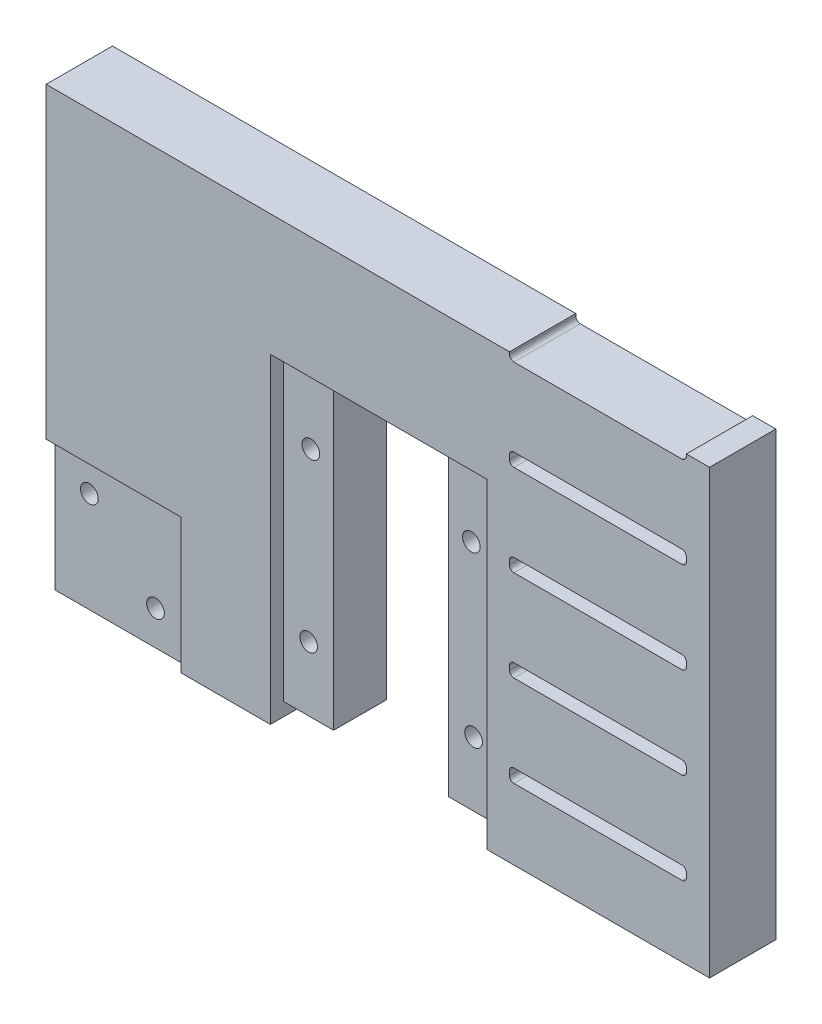
from build123d import *

# Parameters (mm, degrees)
CROQUIS1_W              = 300
CROQUIS1_H              = 200
SALIENTE_EXTRUIR1_DEPTH = 15
CROQUIS2_W              = 30.5
CROQUIS2_H              = 30.5
HUECOS_COLUMNA_DEPTH    = 2
HUECOS_MOTOR_DEPTH      = 181.900525151
CROQUIS4_R              = 2
SIDE_SCREWS_1_DEPTH     = 15
SIDE_START              = -15
CROQUIS5_R              = 2
SIDE_SCREWS_2_DEPTH     = 15
CROQUIS7_R              = 2
SCREWS_AND_VENTI_DEPTH  = 15
CROQUIS9_W              = 49
CROQUIS9_H              = 69.5
CORTAR_EXTRUIR6_DEPTH   = 3
CROQUIS11_W             = 15
CROQUIS11_H             = 200
CORTAR_EXTRUIR7_DEPTH   = 150
CROQUIS12_W             = 150
CROQUIS12_H             = 15
CORTAR_EXTRUIR8_DEPTH   = 100


with BuildPart() as part:
    # Croquis1 → Saliente-Extruir1 (new body)
    with BuildSketch(Plane.XY):
        Rectangle(CROQUIS1_W, CROQUIS1_H)
    extrude(amount=SALIENTE_EXTRUIR1_DEPTH)

    # Croquis2 → Huecos columna (cut)
    with BuildSketch(Plane.XY.offset(15)):
        with Locations((-134.75, 84.75)):
            Rectangle(CROQUIS2_W, CROQUIS2_H)
        with Locations((134.75, 84.75)):
            Rectangle(CROQUIS2_W, CROQUIS2_H)
        with Locations((134.75, -84.75)):
            Rectangle(CROQUIS2_W, CROQUIS2_H)
        with Locations((-134.75, -84.75)):
            Rectangle(CROQUIS2_W, CROQUIS2_H)
    extrude(amount=-HUECOS_COLUMNA_DEPTH, mode=Mode.SUBTRACT)

    # Croquis3 → huecos motor (cut, through all)
    with BuildSketch(Plane.XY.offset(15)):
        Polygon((-88, -97), (-88, -27.5), (-62, -27.5), (-62, -97), (-50.295392228, -97), (-50.295392228, -100), (-99.295392228, -100), (-99.295392228, -97), align=None)
        Polygon((88, -27.5), (62, -27.5), (62, -97), (50.295392228, -97), (50.295392228, -100), (99.295392228, -100), (99.295392228, -97), (88, -97), align=None)
        Polygon((88, 97), (88, 27.5), (62, 27.5), (62, 97), (50.295392228, 97), (50.295392228, 100), (99.295392228, 100), (99.295392228, 97), align=None)
        Polygon((-88, 27.5), (-62, 27.5), (-62, 97), (-50.295392228, 97), (-50.295392228, 100), (-99.295392228, 100), (-99.295392228, 97), (-88, 97), align=None)
    extrude(amount=-HUECOS_MOTOR_DEPTH, mode=Mode.SUBTRACT)

    # Croquis4 → side_screws 1 (cut)
    with BuildSketch(Plane.XZ.offset(97)):
        with Locations((-93.647696114, 7.5)):
            Circle(CROQUIS4_R)
        with Locations((-56.352303886, 7.5)):
            Circle(CROQUIS4_R)
        with Locations((56.352303886, 7.5)):
            Circle(CROQUIS4_R)
        with Locations((93.647696114, 7.5)):
            Circle(CROQUIS4_R)
    extrude(amount=-SIDE_SCREWS_1_DEPTH, mode=Mode.SUBTRACT)

    # Croquis5 → side screws 2 (cut)
    with BuildSketch(Plane(origin=(0, 97, 0), x_dir=(1, 0, 0), z_dir=(0, 1, 0)).offset(SIDE_START)):
        with Locations((-93.647696114, -7.5)):
            Circle(CROQUIS5_R)
        with Locations((-56.352303886, -7.5)):
            Circle(CROQUIS5_R)
        with Locations((56.352303886, -7.5)):
            Circle(CROQUIS5_R)
        with Locations((93.647696114, -7.5)):
            Circle(CROQUIS5_R)
    extrude(amount=SIDE_SCREWS_2_DEPTH, mode=Mode.SUBTRACT)

    # Croquis7 → screws and venti (cut)
    with BuildSketch(Plane.XY.offset(15)):
        with Locations((-127.278174593, -92.221825407)):
            Circle(CROQUIS7_R)
        with Locations((-142.221825407, -77.278174593)):
            Circle(CROQUIS7_R)
        with Locations((-127.278174593, 92.221825407)):
            Circle(CROQUIS7_R)
        with Locations((-142.221825407, 77.278174593)):
            Circle(CROQUIS7_R)
        with Locations((127.278174593, -92.221825407)):
            Circle(CROQUIS7_R)
        with Locations((142.221825407, -77.278174593)):
            Circle(CROQUIS7_R)
        with Locations((127.278174593, 92.221825407)):
            Circle(CROQUIS7_R)
        with Locations((142.221825407, 77.278174593)):
            Circle(CROQUIS7_R)
        with Locations((-93.647696114, -82.5)):
            Circle(CROQUIS7_R)
        with Locations((-93.147733982, -44.503289118)):
            Circle(CROQUIS7_R)
        with Locations((-56.352303886, -82.5)):
            Circle(CROQUIS7_R)
        with Locations((-56.852266018, -44.503289118)):
            Circle(CROQUIS7_R)
        with Locations((56.852266018, -44.503289118)):
            Circle(CROQUIS7_R)
        with Locations((56.352303886, -82.5)):
            Circle(CROQUIS7_R)
        with Locations((93.647696114, -82.5)):
            Circle(CROQUIS7_R)
        with Locations((93.147733982, -44.503289118)):
            Circle(CROQUIS7_R)
        with Locations((93.647696114, 82.5)):
            Circle(CROQUIS7_R)
        with Locations((93.147733982, 44.503289118)):
            Circle(CROQUIS7_R)
        with Locations((56.352303886, 82.5)):
            Circle(CROQUIS7_R)
        with Locations((56.852266018, 44.503289118)):
            Circle(CROQUIS7_R)
        with Locations((-56.352303886, 82.5)):
            Circle(CROQUIS7_R)
        with Locations((-56.852266018, 44.503289118)):
            Circle(CROQUIS7_R)
        with Locations((-93.647696114, 82.5)):
            Circle(CROQUIS7_R)
        with Locations((-93.147733982, 44.503289118)):
            Circle(CROQUIS7_R)
        with BuildLine():
            Line((6.875948392, 84), (44.875948392, 84))
            ThreePointArc((44.875948392, 84), (45.583055173, 83.707106781), (45.875948392, 83))
            Line((45.875948392, 83), (45.875948392, 82))
            ThreePointArc((45.875948392, 82), (45.583055173, 81.292893219), (44.875948392, 81))
            Line((44.875948392, 81), (6.875948392, 81))
            ThreePointArc((6.875948392, 81), (6.168841611, 81.292893219), (5.875948392, 82))
            Line((5.875948392, 82), (5.875948392, 83))
            ThreePointArc((5.875948392, 83), (6.168841611, 83.707106781), (6.875948392, 84))
        make_face()
        with BuildLine():
            Line((-44.236036181, 81), (-6.236036181, 81))
            ThreePointArc((-6.236036181, 81), (-5.5289294, 81.292893219), (-5.236036181, 82))
            Line((-5.236036181, 82), (-5.236036181, 83))
            ThreePointArc((-5.236036181, 83), (-5.5289294, 83.707106781), (-6.236036181, 84))
            Line((-6.236036181, 84), (-44.236036181, 84))
            ThreePointArc((-44.236036181, 84), (-44.943142962, 83.707106781), (-45.236036181, 83))
            Line((-45.236036181, 83), (-45.236036181, 82))
            ThreePointArc((-45.236036181, 82), (-44.943142962, 81.292893219), (-44.236036181, 81))
        make_face()
        with BuildLine():
            Line((6.875948392, 63.375), (44.875948392, 63.375))
            ThreePointArc((44.875948392, 63.375), (45.583055173, 63.082106781), (45.875948392, 62.375))
            Line((45.875948392, 62.375), (45.875948392, 61.375))
            ThreePointArc((45.875948392, 61.375), (45.583055173, 60.667893219), (44.875948392, 60.375))
            Line((44.875948392, 60.375), (6.875948392, 60.375))
            ThreePointArc((6.875948392, 60.375), (6.168841611, 60.667893219), (5.875948392, 61.375))
            Line((5.875948392, 61.375), (5.875948392, 62.375))
            ThreePointArc((5.875948392, 62.375), (6.168841611, 63.082106781), (6.875948392, 63.375))
        make_face()
        with BuildLine():
            Line((6.875948392, 42.75), (44.875948392, 42.75))
            ThreePointArc((44.875948392, 42.75), (45.583055173, 42.457106781), (45.875948392, 41.75))
            Line((45.875948392, 41.75), (45.875948392, 40.75))
            ThreePointArc((45.875948392, 40.75), (45.583055173, 40.042893219), (44.875948392, 39.75))
            Line((44.875948392, 39.75), (6.875948392, 39.75))
            ThreePointArc((6.875948392, 39.75), (6.168841611, 40.042893219), (5.875948392, 40.75))
            Line((5.875948392, 40.75), (5.875948392, 41.75))
            ThreePointArc((5.875948392, 41.75), (6.168841611, 42.457106781), (6.875948392, 42.75))
        make_face()
        with BuildLine():
            Line((6.875948392, 22.125), (44.875948392, 22.125))
            ThreePointArc((44.875948392, 22.125), (45.583055173, 21.832106781), (45.875948392, 21.125))
            Line((45.875948392, 21.125), (45.875948392, 20.125))
            ThreePointArc((45.875948392, 20.125), (45.583055173, 19.417893219), (44.875948392, 19.125))
            Line((44.875948392, 19.125), (6.875948392, 19.125))
            ThreePointArc((6.875948392, 19.125), (6.168841611, 19.417893219), (5.875948392, 20.125))
            Line((5.875948392, 20.125), (5.875948392, 21.125))
            ThreePointArc((5.875948392, 21.125), (6.168841611, 21.832106781), (6.875948392, 22.125))
        make_face()
        with BuildLine():
            Line((6.875948392, 1.5), (44.875948392, 1.5))
            ThreePointArc((44.875948392, 1.5), (45.583055173, 1.207106781), (45.875948392, 0.5))
            Line((45.875948392, 0.5), (45.875948392, -0.5))
            ThreePointArc((45.875948392, -0.5), (45.583055173, -1.207106781), (44.875948392, -1.5))
            Line((44.875948392, -1.5), (6.875948392, -1.5))
            ThreePointArc((6.875948392, -1.5), (6.168841611, -1.207106781), (5.875948392, -0.5))
            Line((5.875948392, -0.5), (5.875948392, 0.5))
            ThreePointArc((5.875948392, 0.5), (6.168841611, 1.207106781), (6.875948392, 1.5))
        make_face()
        with BuildLine():
            Line((6.875948392, -19.125), (44.875948392, -19.125))
            ThreePointArc((44.875948392, -19.125), (45.583055173, -19.417893219), (45.875948392, -20.125))
            Line((45.875948392, -20.125), (45.875948392, -21.125))
            ThreePointArc((45.875948392, -21.125), (45.583055173, -21.832106781), (44.875948392, -22.125))
            Line((44.875948392, -22.125), (6.875948392, -22.125))
            ThreePointArc((6.875948392, -22.125), (6.168841611, -21.832106781), (5.875948392, -21.125))
            Line((5.875948392, -21.125), (5.875948392, -20.125))
            ThreePointArc((5.875948392, -20.125), (6.168841611, -19.417893219), (6.875948392, -19.125))
        make_face()
        with BuildLine():
            Line((6.875948392, -39.75), (44.875948392, -39.75))
            ThreePointArc((44.875948392, -39.75), (45.583055173, -40.042893219), (45.875948392, -40.75))
            Line((45.875948392, -40.75), (45.875948392, -41.75))
            ThreePointArc((45.875948392, -41.75), (45.583055173, -42.457106781), (44.875948392, -42.75))
            Line((44.875948392, -42.75), (6.875948392, -42.75))
            ThreePointArc((6.875948392, -42.75), (6.168841611, -42.457106781), (5.875948392, -41.75))
            Line((5.875948392, -41.75), (5.875948392, -40.75))
            ThreePointArc((5.875948392, -40.75), (6.168841611, -40.042893219), (6.875948392, -39.75))
        make_face()
        with BuildLine():
            Line((6.875948392, -60.375), (44.875948392, -60.375))
            ThreePointArc((44.875948392, -60.375), (45.583055173, -60.667893219), (45.875948392, -61.375))
            Line((45.875948392, -61.375), (45.875948392, -62.375))
            ThreePointArc((45.875948392, -62.375), (45.583055173, -63.082106781), (44.875948392, -63.375))
            Line((44.875948392, -63.375), (6.875948392, -63.375))
            ThreePointArc((6.875948392, -63.375), (6.168841611, -63.082106781), (5.875948392, -62.375))
            Line((5.875948392, -62.375), (5.875948392, -61.375))
            ThreePointArc((5.875948392, -61.375), (6.168841611, -60.667893219), (6.875948392, -60.375))
        make_face()
        with BuildLine():
            Line((6.875948392, -81), (44.875948392, -81))
            ThreePointArc((44.875948392, -81), (45.583055173, -81.292893219), (45.875948392, -82))
            Line((45.875948392, -82), (45.875948392, -83))
            ThreePointArc((45.875948392, -83), (45.583055173, -83.707106781), (44.875948392, -84))
            Line((44.875948392, -84), (6.875948392, -84))
            ThreePointArc((6.875948392, -84), (6.168841611, -83.707106781), (5.875948392, -83))
            Line((5.875948392, -83), (5.875948392, -82))
            ThreePointArc((5.875948392, -82), (6.168841611, -81.292893219), (6.875948392, -81))
        make_face()
        with BuildLine():
            Line((-44.236036181, 63.375), (-6.236036181, 63.375))
            ThreePointArc((-6.236036181, 63.375), (-5.5289294, 63.082106781), (-5.236036181, 62.375))
            Line((-5.236036181, 62.375), (-5.236036181, 61.375))
            ThreePointArc((-5.236036181, 61.375), (-5.5289294, 60.667893219), (-6.236036181, 60.375))
            Line((-6.236036181, 60.375), (-44.236036181, 60.375))
            ThreePointArc((-44.236036181, 60.375), (-44.943142962, 60.667893219), (-45.236036181, 61.375))
            Line((-45.236036181, 61.375), (-45.236036181, 62.375))
            ThreePointArc((-45.236036181, 62.375), (-44.943142962, 63.082106781), (-44.236036181, 63.375))
        make_face()
        with BuildLine():
            Line((-44.236036181, 42.75), (-6.236036181, 42.75))
            ThreePointArc((-6.236036181, 42.75), (-5.5289294, 42.457106781), (-5.236036181, 41.75))
            Line((-5.236036181, 41.75), (-5.236036181, 40.75))
            ThreePointArc((-5.236036181, 40.75), (-5.5289294, 40.042893219), (-6.236036181, 39.75))
            Line((-6.236036181, 39.75), (-44.236036181, 39.75))
            ThreePointArc((-44.236036181, 39.75), (-44.943142962, 40.042893219), (-45.236036181, 40.75))
            Line((-45.236036181, 40.75), (-45.236036181, 41.75))
            ThreePointArc((-45.236036181, 41.75), (-44.943142962, 42.457106781), (-44.236036181, 42.75))
        make_face()
        with BuildLine():
            Line((-44.236036181, 22.125), (-6.236036181, 22.125))
            ThreePointArc((-6.236036181, 22.125), (-5.5289294, 21.832106781), (-5.236036181, 21.125))
            Line((-5.236036181, 21.125), (-5.236036181, 20.125))
            ThreePointArc((-5.236036181, 20.125), (-5.5289294, 19.417893219), (-6.236036181, 19.125))
            Line((-6.236036181, 19.125), (-44.236036181, 19.125))
            ThreePointArc((-44.236036181, 19.125), (-44.943142962, 19.417893219), (-45.236036181, 20.125))
            Line((-45.236036181, 20.125), (-45.236036181, 21.125))
            ThreePointArc((-45.236036181, 21.125), (-44.943142962, 21.832106781), (-44.236036181, 22.125))
        make_face()
        with BuildLine():
            Line((-44.236036181, 1.5), (-6.236036181, 1.5))
            ThreePointArc((-6.236036181, 1.5), (-5.5289294, 1.207106781), (-5.236036181, 0.5))
            Line((-5.236036181, 0.5), (-5.236036181, -0.5))
            ThreePointArc((-5.236036181, -0.5), (-5.5289294, -1.207106781), (-6.236036181, -1.5))
            Line((-6.236036181, -1.5), (-44.236036181, -1.5))
            ThreePointArc((-44.236036181, -1.5), (-44.943142962, -1.207106781), (-45.236036181, -0.5))
            Line((-45.236036181, -0.5), (-45.236036181, 0.5))
            ThreePointArc((-45.236036181, 0.5), (-44.943142962, 1.207106781), (-44.236036181, 1.5))
        make_face()
        with BuildLine():
            Line((-44.236036181, -19.125), (-6.236036181, -19.125))
            ThreePointArc((-6.236036181, -19.125), (-5.5289294, -19.417893219), (-5.236036181, -20.125))
            Line((-5.236036181, -20.125), (-5.236036181, -21.125))
            ThreePointArc((-5.236036181, -21.125), (-5.5289294, -21.832106781), (-6.236036181, -22.125))
            Line((-6.236036181, -22.125), (-44.236036181, -22.125))
            ThreePointArc((-44.236036181, -22.125), (-44.943142962, -21.832106781), (-45.236036181, -21.125))
            Line((-45.236036181, -21.125), (-45.236036181, -20.125))
            ThreePointArc((-45.236036181, -20.125), (-44.943142962, -19.417893219), (-44.236036181, -19.125))
        make_face()
        with BuildLine():
            Line((-44.236036181, -39.75), (-6.236036181, -39.75))
            ThreePointArc((-6.236036181, -39.75), (-5.5289294, -40.042893219), (-5.236036181, -40.75))
            Line((-5.236036181, -40.75), (-5.236036181, -41.75))
            ThreePointArc((-5.236036181, -41.75), (-5.5289294, -42.457106781), (-6.236036181, -42.75))
            Line((-6.236036181, -42.75), (-44.236036181, -42.75))
            ThreePointArc((-44.236036181, -42.75), (-44.943142962, -42.457106781), (-45.236036181, -41.75))
            Line((-45.236036181, -41.75), (-45.236036181, -40.75))
            ThreePointArc((-45.236036181, -40.75), (-44.943142962, -40.042893219), (-44.236036181, -39.75))
        make_face()
        with BuildLine():
            Line((-44.236036181, -60.375), (-6.236036181, -60.375))
            ThreePointArc((-6.236036181, -60.375), (-5.5289294, -60.667893219), (-5.236036181, -61.375))
            Line((-5.236036181, -61.375), (-5.236036181, -62.375))
            ThreePointArc((-5.236036181, -62.375), (-5.5289294, -63.082106781), (-6.236036181, -63.375))
            Line((-6.236036181, -63.375), (-44.236036181, -63.375))
            ThreePointArc((-44.236036181, -63.375), (-44.943142962, -63.082106781), (-45.236036181, -62.375))
            Line((-45.236036181, -62.375), (-45.236036181, -61.375))
            ThreePointArc((-45.236036181, -61.375), (-44.943142962, -60.667893219), (-44.236036181, -60.375))
        make_face()
        with BuildLine():
            Line((-44.236036181, -81), (-6.236036181, -81))
            ThreePointArc((-6.236036181, -81), (-5.5289294, -81.292893219), (-5.236036181, -82))
            Line((-5.236036181, -82), (-5.236036181, -83))
            ThreePointArc((-5.236036181, -83), (-5.5289294, -83.707106781), (-6.236036181, -84))
            Line((-6.236036181, -84), (-44.236036181, -84))
            ThreePointArc((-44.236036181, -84), (-44.943142962, -83.707106781), (-45.236036181, -83))
            Line((-45.236036181, -83), (-45.236036181, -82))
            ThreePointArc((-45.236036181, -82), (-44.943142962, -81.292893219), (-44.236036181, -81))
        make_face()
    extrude(amount=-SCREWS_AND_VENTI_DEPTH, mode=Mode.SUBTRACT)

    # Croquis9 → Cortar-Extruir6 (cut)
    with BuildSketch(Plane.XY.offset(15)):
        with Locations((-74.795392228, -62.25)):
            Rectangle(CROQUIS9_W, CROQUIS9_H)
        with Locations((74.795392228, -62.25)):
            Rectangle(CROQUIS9_W, CROQUIS9_H)
        with Locations((74.795392228, 62.25)):
            Rectangle(CROQUIS9_W, CROQUIS9_H)
        with Locations((-74.795392228, 62.25)):
            Rectangle(CROQUIS9_W, CROQUIS9_H)
    extrude(amount=-CORTAR_EXTRUIR6_DEPTH, mode=Mode.SUBTRACT)

    # Croquis11 → Cortar-Extruir7 (cut)
    with BuildSketch(Plane(origin=(150, 0, 0), x_dir=(0, 0, -1), z_dir=(1, 0, 0))):
        with Locations((-7.5, 0)):
            Rectangle(CROQUIS11_W, CROQUIS11_H)
    extrude(amount=-CORTAR_EXTRUIR7_DEPTH, mode=Mode.SUBTRACT)

    # Croquis12 → Cortar-Extruir8 (cut)
    with BuildSketch(Plane(origin=(0, 100, 0), x_dir=(1, 0, 0), z_dir=(0, 1, 0))):
        with Locations((-75, -7.5)):
            Rectangle(CROQUIS12_W, CROQUIS12_H)
    extrude(amount=-CORTAR_EXTRUIR8_DEPTH, mode=Mode.SUBTRACT)


solid = part.part
